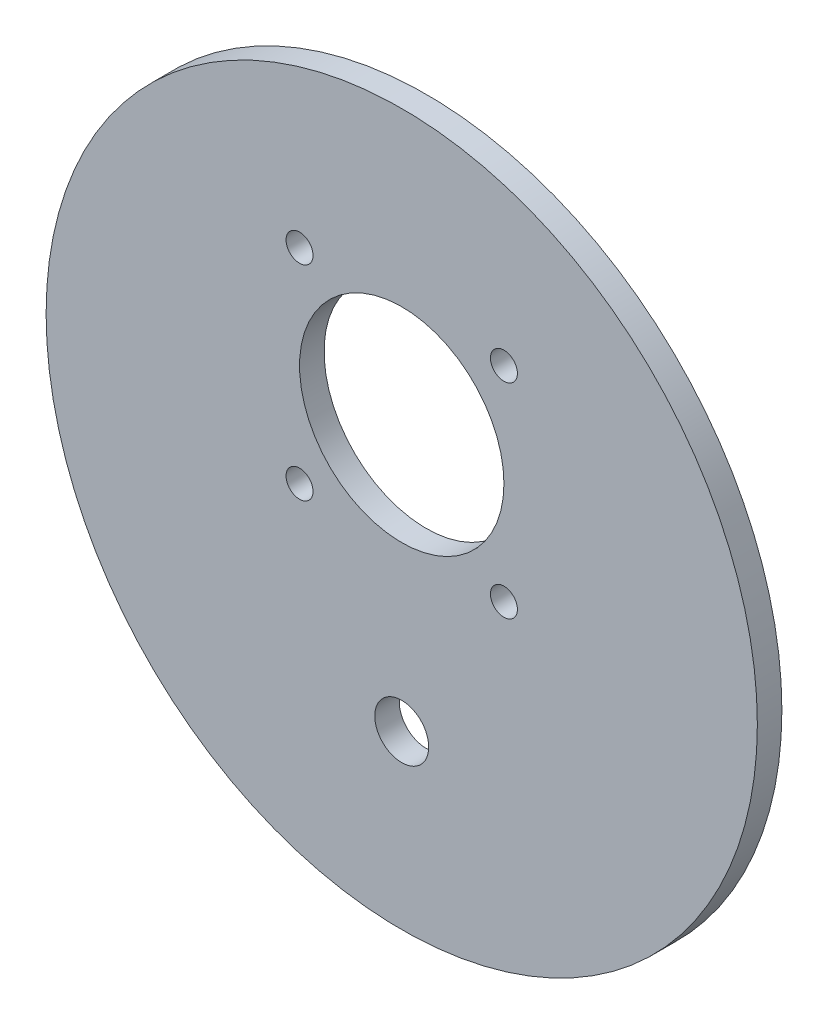
from build123d import *

# Parameters (mm, degrees)
SKETCH1_R               = 43.5
SKETCH1_R_2             = 1.65
SKETCH1_R_3             = 12.5
BOSS_EXTRUDE1_DEPTH     = 3
CUT_EXTRUDE1_DEPTH      = 62.591395503
CUT_EXTRUDE1_DEPTH_BACK = 62.591395503
SKETCH2_R               = 3.3


with BuildPart() as part:
    # Sketch1 → Boss-Extrude1 (new body)
    with BuildSketch(Plane.XY):
        Circle(SKETCH1_R)
        with Locations((-12.5, -2.5)):
            Circle(SKETCH1_R_2, mode=Mode.SUBTRACT)
        with Locations((12.5, -2.5)):
            Circle(SKETCH1_R_2, mode=Mode.SUBTRACT)
        with Locations((12.5, 22.5)):
            Circle(SKETCH1_R_2, mode=Mode.SUBTRACT)
        with Locations((-12.5, 22.5)):
            Circle(SKETCH1_R_2, mode=Mode.SUBTRACT)
        with Locations((0, 10)):
            Circle(SKETCH1_R_3, mode=Mode.SUBTRACT)
    extrude(amount=BOSS_EXTRUDE1_DEPTH)

    # Sketch2 → Cut-Extrude1 (cut, two sides: drawn at the far end of the back side and taken through both)
    with BuildSketch(Plane.XY.offset(3).offset(-CUT_EXTRUDE1_DEPTH_BACK)):
        with Locations((0, -22.5)):
            Circle(SKETCH2_R)
    extrude(amount=CUT_EXTRUDE1_DEPTH + CUT_EXTRUDE1_DEPTH_BACK, mode=Mode.SUBTRACT)


solid = part.part
